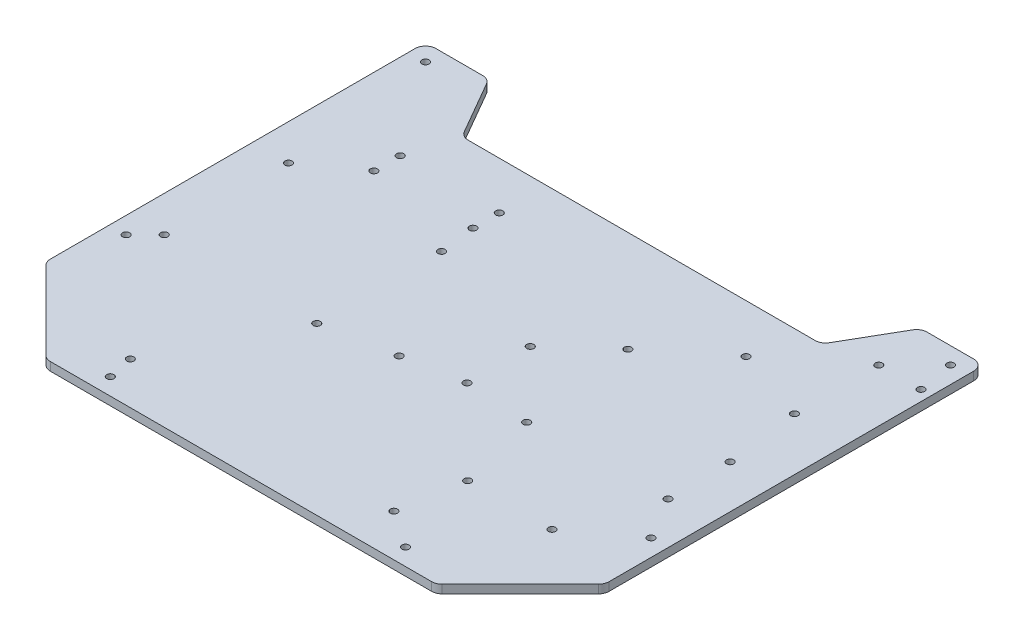
from build123d import *

# Parameters (mm, degrees)
MAIN_EXTRUSION_DEPTH    = 4
CONG_1_R                = 5
ESQUISSE1_R             = 1
ENL_V_MAT_EXTRU_1_DEPTH = 257.850637531
D_GAGEMENT_M31_D        = 3.4
ESQUISSE4_R             = 1
ENL_V_MAT_EXTRU_2_DEPTH = 257.850637531
D_GAGEMENT_M32_D        = 3.4


with BuildPart() as part:
    # Main scetch → Main extrusion (new body)
    with BuildSketch(Plane(origin=(0, 0, 0), x_dir=(1, 0, 0), z_dir=(0, 1, 0))):
        Polygon((-92.5, 0), (92.5, 0), (132.5, 40), (132.5, 220), (102.5, 220), (85.179491924, 190), (-85.179491924, 190), (-102.5, 220), (-132.5, 220), (-132.5, 40), align=None)
    extrude(amount=MAIN_EXTRUSION_DEPTH)

    # Congé1
    cong_1_edges = [part.edges().sort_by_distance(p)[0] for p in [
        (-132.5, 2, -40),
        (-92.5, 2, 0),
        (92.5, 2, 0),
        (132.5, 2, -40),
        (132.5, 2, -220),
        (102.5, 2, -220),
        (85.179491924, 2, -190),
        (-85.179491924, 2, -190),
        (-102.5, 2, -220),
        (-132.5, 2, -220),
    ]]
    fillet(cong_1_edges, radius=CONG_1_R)

    # Esquisse1 → Enlèv. mat.-Extru.1 (cut, through all)
    with BuildSketch(Plane(origin=(0, 4, 0), x_dir=(1, 0, 0), z_dir=(0, 1, 0))):
        with Locations((70, 8)):
            Circle(ESQUISSE1_R)
        with Locations((124.5, 70)):
            Circle(ESQUISSE1_R)
        with Locations((124.5, 212)):
            Circle(ESQUISSE1_R)
        with Locations((-124.5, 212)):
            Circle(ESQUISSE1_R)
        with Locations((-124.5, 70)):
            Circle(ESQUISSE1_R)
        with Locations((-70, 8)):
            Circle(ESQUISSE1_R)
    extrude(amount=-ENL_V_MAT_EXTRU_1_DEPTH, mode=Mode.SUBTRACT)

    # Dégagement M31 (through all)
    with Locations(Plane(origin=(0, 4, 0), x_dir=(1, 0, 0), z_dir=(0, 1, 0))):
        with Locations((-124.5, 212), (-124.5, 70), (-70, 8), (70, 8), (124.5, 70), (124.5, 212)):
            Hole(D_GAGEMENT_M31_D / 2)

    # Esquisse4 → Enlèv. mat.-Extru.2 (cut, through all)
    with BuildSketch(Plane(origin=(0, 4, 0), x_dir=(1, 0, 0), z_dir=(0, 1, 0))):
        with Locations((72.5, 167)):
            Circle(ESQUISSE4_R)
        with Locations((41.5, 142)):
            Circle(ESQUISSE4_R)
        with Locations((107.5, 155)):
            Circle(ESQUISSE4_R)
        with Locations((127.5, 195)):
            Circle(ESQUISSE4_R)
        with Locations((112, 120)):
            Circle(ESQUISSE4_R)
        with Locations((112.5, 90)):
            Circle(ESQUISSE4_R)
        with Locations((17.2, 120)):
            Circle(ESQUISSE4_R)
        with Locations((17.2, 90)):
            Circle(ESQUISSE4_R)
        with Locations((47.5, 88)):
            Circle(ESQUISSE4_R)
        with Locations((57.5, 50)):
            Circle(ESQUISSE4_R)
        with Locations((97.5, 50)):
            Circle(ESQUISSE4_R)
        with Locations((52.5, 20)):
            Circle(ESQUISSE4_R)
        with Locations((-10, 85)):
            Circle(ESQUISSE4_R)
        with Locations((-72.5, 20)):
            Circle(ESQUISSE4_R)
        with Locations((107.5, 195)):
            Circle(ESQUISSE4_R)
        with Locations((-115.5, 138)):
            Circle(ESQUISSE4_R)
        with Locations((-42.86, 138)):
            Circle(ESQUISSE4_R)
        with Locations((-115.5, 79.07)):
            Circle(ESQUISSE4_R)
        with Locations((-42.890430383, 78.82)):
            Circle(ESQUISSE4_R)
        with Locations((-92, 167.5)):
            Circle(ESQUISSE4_R)
        with Locations((-45, 167.5)):
            Circle(ESQUISSE4_R)
        with Locations((-92, 155)):
            Circle(ESQUISSE4_R)
        with Locations((-45, 155)):
            Circle(ESQUISSE4_R)
    extrude(amount=-ENL_V_MAT_EXTRU_2_DEPTH, mode=Mode.SUBTRACT)

    # Dégagement M32 (through all)
    with Locations(Plane(origin=(0, 4, 0), x_dir=(1, 0, 0), z_dir=(0, 1, 0))):
        with Locations((17.2, 120), (41.5, 142), (72.5, 167), (107.5, 155), (127.5, 195), (112, 120), (112.5, 90), (47.5, 88), (17.2, 90), (57.5, 50), (97.5, 50), (-10, 85), (-72.5, 20), (52.5, 20), (107.5, 195), (-115.5, 138), (-42.86, 138), (-115.5, 79.07), (-42.890430383, 78.82), (-92, 167.5), (-92, 155), (-45, 155), (-45, 167.5)):
            Hole(D_GAGEMENT_M32_D / 2)


solid = part.part
